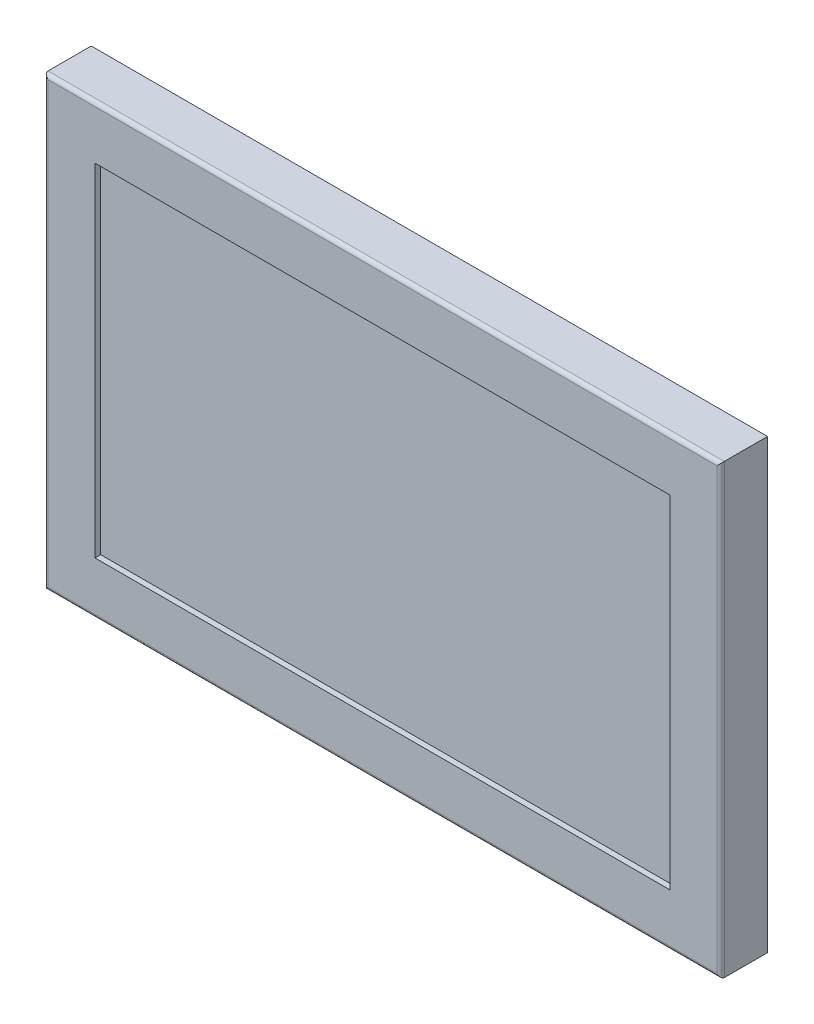
from build123d import *

# Parameters (mm, degrees)
SKETCH_1_W                  = 180
SKETCH_1_H                  = 119
EXTRUDE_1_DEPTH             = 12.5
SKETCH_2_W                  = 153
SKETCH_2_H                  = 91
CUT_EXTRUDE_1_DEPTH         = 1.5
SKETCH_3_W                  = 154.4
SKETCH_3_H                  = 94.5
EXTRUDE_2_DEPTH             = 31.5
SKETCH_7_R                  = 1.6
EXTRUDE_4_DEPTH             = 3
PATTERN_LINEAR_1_COUNT      = 5
PATTERN_LINEAR_1_PITCH      = 13.5
SKETCH_8_R                  = 1.75
CUT_EXTRUDE_3_DEPTH         = 3
SKETCH_9_R                  = 1.5
EXTRUDE_5_DEPTH             = 3
FILLET_1_R                  = 1.5
HOLE_WIZARD_M4_1_AT_2_COUNT = 2
HOLE_WIZARD_M4_1_AT_2_PITCH = 75
HOLE_WIZARD_M4_1_AT_3_COUNT = 2
HOLE_WIZARD_M4_1_AT_3_PITCH = 75
HOLE_WIZARD_M4_1_AT_4_COUNT = 2
HOLE_WIZARD_M4_1_AT_4_PITCH = 106.066017178
SKETCH_12_W                 = 10
SKETCH_12_H                 = 12.5
CUT_EXTRUDE_4_DEPTH         = 5
SKETCH_13_W                 = 9.5
SKETCH_13_H                 = 10
SKETCH_13_R                 = 3
EXTRUDE_6_DEPTH             = 5
SKETCH_13_R_2               = 0.75
EXTRUDE_6_2_DEPTH           = 5
FILLET_2_R                  = 0.75
SKETCH_14_R                 = 5
CUT_EXTRUDE_5_DEPTH         = 2
SKETCH_15_R                 = 4.125
SKETCH_15_R_2               = 1.675
EXTRUDE_7_DEPTH             = 6.5
FILLET_3_R                  = 0.5
CUT_EXTRUDE_6_DEPTH         = 3
CUT_EXTRUDE_7_DEPTH         = 3
EXTRUDE_8_DEPTH             = 5
EXTRUDE_9_DEPTH             = 5
CUT_EXTRUDE_8_DEPTH         = 3
SKETCH_21_R                 = 2.25
FILLET_8_R                  = 1
SKETCH_22_R                 = 1
CUT_EXTRUDE_9_DEPTH         = 10
SCALE1_SCALE                = 2


with BuildPart() as part:
    # 스케치1 → 보스-돌출1 (new body)
    with BuildSketch(Plane.XY):
        Rectangle(SKETCH_1_W, SKETCH_1_H)
    extrude(amount=-EXTRUDE_1_DEPTH)

    # 스케치2 → 컷-돌출1 (cut)
    with BuildSketch(Plane.XY):
        Rectangle(SKETCH_2_W, SKETCH_2_H)
    extrude(amount=-CUT_EXTRUDE_1_DEPTH, mode=Mode.SUBTRACT)

    # 필렛8
    fillet_8_edges = [part.edges().sort_by_distance(p)[0] for p in [
        (0, -59.5, 0),
        (90, 0, 0),
        (0, 59.5, 0),
        (-90, 0, 0),
    ]]
    fillet(fillet_8_edges, radius=FILLET_8_R)


with BuildPart() as body_2:
    # 스케치3 → 보스-돌출2 (new body)
    with BuildSketch(Plane(origin=(0, 0, -12.5), x_dir=(-1, 0, 0), z_dir=(0, 0, -1))):
        with Locations((0, 4.25)):
            Rectangle(SKETCH_3_W, SKETCH_3_H)
    extrude(amount=EXTRUDE_2_DEPTH)

    # 스케치7 → 보스-돌출4 (add)
    with BuildSketch(Plane(origin=(0, 51.5, 0), x_dir=(1, 0, 0), z_dir=(0, 1, 0))):
        with Locations((-40.2, 22.5)):
            Circle(SKETCH_7_R)
    extrude_4 = extrude(amount=EXTRUDE_4_DEPTH)

    # 선형 패턴1: 보스-돌출4 ×5
    with Locations(*[(i * PATTERN_LINEAR_1_PITCH, 0, 0) for i in range(1, PATTERN_LINEAR_1_COUNT)]):
        add(extrude_4)

    # 스케치8 → 컷-돌출3 (cut)
    with BuildSketch(Plane(origin=(0, 51.5, 0), x_dir=(1, 0, 0), z_dir=(0, 1, 0))):
        with Locations((25.8, 22.5)):
            Circle(SKETCH_8_R)
    extrude(amount=-CUT_EXTRUDE_3_DEPTH, mode=Mode.SUBTRACT)

    # 스케치9 → 보스-돌출5 (add)
    with BuildSketch(Plane(origin=(0, 48.5, 0), x_dir=(1, 0, 0), z_dir=(0, 1, 0))):
        with Locations((25.8, 22.5)):
            Circle(SKETCH_9_R)
    extrude(amount=EXTRUDE_5_DEPTH)

    # 필렛1
    fillet_1_edges = [body_2.edges().sort_by_distance(p)[0] for p in [
        (24.3, 51.5, -22.5),
    ]]
    fillet(fillet_1_edges, radius=FILLET_1_R)

    # 스케치10 → M4 나사 구멍1 (revolve, cut)
    with BuildSketch(Plane(origin=(37.5, 42, -44), x_dir=(0, 1, 0), z_dir=(1, 0, 0))):
        Polygon((0, 0), (0, 12.491420021), (1.65, 11.5), (1.65, 0), align=None)
    hole_wizard_m4_1 = revolve(axis=Axis((37.5, 42, -50.35), (0, 0, 1)), mode=Mode.SUBTRACT)

    # M4 나사 구멍1 at 2: M4 나사 구멍1 ×2
    with Locations(*[(-i * HOLE_WIZARD_M4_1_AT_2_PITCH, 0, 0) for i in range(1, HOLE_WIZARD_M4_1_AT_2_COUNT)]):
        add(hole_wizard_m4_1, mode=Mode.SUBTRACT)

    # M4 나사 구멍1 at 3: M4 나사 구멍1 ×2
    with Locations(*[(0, -i * HOLE_WIZARD_M4_1_AT_3_PITCH, 0) for i in range(1, HOLE_WIZARD_M4_1_AT_3_COUNT)]):
        add(hole_wizard_m4_1, mode=Mode.SUBTRACT)

    # M4 나사 구멍1 at 4: M4 나사 구멍1 ×2
    with Locations(*[Vector(-0.7071067811865476, -0.7071067811865476, 0) * (i * HOLE_WIZARD_M4_1_AT_4_PITCH) for i in range(1, HOLE_WIZARD_M4_1_AT_4_COUNT)]):
        add(hole_wizard_m4_1, mode=Mode.SUBTRACT)

    # 스케치12 → 컷-돌출4 (cut)
    with BuildSketch(Plane.XZ.offset(43)):
        with Locations((-30.2, -22.5)):
            Rectangle(SKETCH_12_W, SKETCH_12_H)
    extrude(amount=-CUT_EXTRUDE_4_DEPTH, mode=Mode.SUBTRACT)

    # 스케치14 → 컷-돌출5 (cut)
    with BuildSketch(Plane.XZ.offset(43)):
        with Locations((-19.2, -22.5)):
            Circle(SKETCH_14_R)
    extrude(amount=-CUT_EXTRUDE_5_DEPTH, mode=Mode.SUBTRACT)

    # 스케치16 → 컷-돌출6 (cut)
    with BuildSketch(Plane.XZ.offset(43)):
        with BuildLine():
            Line((11.15, -28), (-6.85, -28))
            ThreePointArc((-6.85, -28), (-8.004263662, -27.457953756), (-8.32430828, -26.223567197))
            Line((-8.32430828, -26.223567197), (-8.282389431, -26))
            Line((-8.282389431, -26), (-10.6, -26))
            ThreePointArc((-10.6, -26), (-14.1, -22.5), (-10.6, -19))
            Line((-10.6, -19), (-6.969889431, -19))
            Line((-6.969889431, -19), (-6.82430828, -18.223567197))
            ThreePointArc((-6.82430828, -18.223567197), (-6.307953756, -17.345736338), (-5.35, -17))
            Line((-5.35, -17), (9.65, -17))
            ThreePointArc((9.65, -17), (10.607953756, -17.345736338), (11.12430828, -18.223567197))
            Line((11.12430828, -18.223567197), (11.269889431, -19))
            Line((11.269889431, -19), (14.9, -19))
            ThreePointArc((14.9, -19), (18.4, -22.5), (14.9, -26))
            Line((14.9, -26), (12.582389431, -26))
            Line((12.582389431, -26), (12.62430828, -26.223567197))
            ThreePointArc((12.62430828, -26.223567197), (12.304263662, -27.457953756), (11.15, -28))
        make_face()
    extrude(amount=-CUT_EXTRUDE_6_DEPTH, mode=Mode.SUBTRACT)

    # 스케치17 → 컷-돌출7 (cut)
    with BuildSketch(Plane.XZ.offset(43)):
        with BuildLine():
            Line((52.25, -26.5), (28.25, -26.5))
            ThreePointArc((28.25, -26.5), (27.095736338, -25.957953756), (26.77569172, -24.723567197))
            Line((26.77569172, -24.723567197), (26.817610569, -24.5))
            Line((26.817610569, -24.5), (24.5, -24.5))
            ThreePointArc((24.5, -24.5), (21, -21), (24.5, -17.5))
            Line((24.5, -17.5), (28.130110569, -17.5))
            Line((28.130110569, -17.5), (28.27569172, -16.723567197))
            ThreePointArc((28.27569172, -16.723567197), (28.792046244, -15.845736338), (29.75, -15.5))
            Line((29.75, -15.5), (50.75, -15.5))
            ThreePointArc((50.75, -15.5), (51.707953756, -15.845736338), (52.22430828, -16.723567197))
            Line((52.22430828, -16.723567197), (52.369889431, -17.5))
            Line((52.369889431, -17.5), (56, -17.5))
            ThreePointArc((56, -17.5), (59.5, -21), (56, -24.5))
            Line((56, -24.5), (53.682389431, -24.5))
            Line((53.682389431, -24.5), (53.72430828, -24.723567197))
            ThreePointArc((53.72430828, -24.723567197), (53.404263662, -25.957953756), (52.25, -26.5))
        make_face()
    extrude(amount=-CUT_EXTRUDE_7_DEPTH, mode=Mode.SUBTRACT)

    # 스케치18 → 보스-돌출8 (add)
    with BuildSketch(Plane.XZ.offset(40)):
        Polygon((-12.909401077, -22.5), (-11.754700538, -24.5), (-9.445299462, -24.5), (-8.290598923, -22.5), (-9.445299462, -20.5), (-11.754700538, -20.5), align=None)
        Polygon((12.590598923, -22.5), (13.745299462, -24.5), (16.054700538, -24.5), (17.209401077, -22.5), (16.054700538, -20.5), (13.745299462, -20.5), align=None)
        with BuildLine():
            Line((-4.6, -26.5), (8.9, -26.5))
            ThreePointArc((8.9, -26.5), (9.277726977, -26.327600871), (9.394974747, -25.929289322))
            Line((9.394974747, -25.929289322), (8.394974747, -18.929289322))
            ThreePointArc((8.394974747, -18.929289322), (8.227600871, -18.622273023), (7.9, -18.5))
            Line((7.9, -18.5), (-3.6, -18.5))
            ThreePointArc((-3.6, -18.5), (-3.927600871, -18.622273023), (-4.094974747, -18.929289322))
            Line((-4.094974747, -18.929289322), (-5.094974747, -25.929289322))
            ThreePointArc((-5.094974747, -25.929289322), (-4.977726977, -26.327600871), (-4.6, -26.5))
        make_face()
    extrude(amount=EXTRUDE_8_DEPTH)

    # 스케치19 → 보스-돌출9 (add)
    with BuildSketch(Plane.XZ.offset(40)):
        Polygon((26.809401077, -21), (25.654700538, -19), (23.345299462, -19), (22.190598923, -21), (23.345299462, -23), (25.654700538, -23), align=None)
        Polygon((53.690598923, -21), (54.845299462, -23), (57.154700538, -23), (58.309401077, -21), (57.154700538, -19), (54.845299462, -19), align=None)
        with BuildLine():
            Line((29.75, -17), (50.75, -17))
            ThreePointArc((50.75, -17), (51.103553391, -17.146446609), (51.25, -17.5))
            Line((51.25, -17.5), (51.25, -24.5))
            ThreePointArc((51.25, -24.5), (51.103553391, -24.853553391), (50.75, -25))
            Line((50.75, -25), (29.75, -25))
            ThreePointArc((29.75, -25), (29.396446609, -24.853553391), (29.25, -24.5))
            Line((29.25, -24.5), (29.25, -17.5))
            ThreePointArc((29.25, -17.5), (29.396446609, -17.146446609), (29.75, -17))
        make_face()
    extrude(amount=EXTRUDE_9_DEPTH)

    # 스케치20 → 컷-돌출8 (cut)
    with BuildSketch(Plane.XZ.offset(43)):
        with BuildLine():
            Line((-55.7, -17.5), (-55.7, -12.5))
            Line((-55.7, -12.5), (-63.7, -12.5))
            Line((-63.7, -12.5), (-63.7, -17.5))
            ThreePointArc((-63.7, -17.5), (-59.7, -21.5), (-55.7, -17.5))
        make_face()
    extrude(amount=-CUT_EXTRUDE_8_DEPTH, mode=Mode.SUBTRACT)

    # 스케치22 → 컷-돌출9 (cut)
    with BuildSketch(Plane.XZ.offset(45)):
        with Locations((24.5, -21)):
            Circle(SKETCH_22_R)
        with Locations((56, -21)):
            Circle(SKETCH_22_R)
    extrude(amount=-CUT_EXTRUDE_9_DEPTH, mode=Mode.SUBTRACT)


with BuildPart() as body_3:
    # 스케치13 → 보스-돌출6 (new body)
    with BuildSketch(Plane.XZ.offset(38)):
        with Locations((-30.2, -21.5)):
            Rectangle(SKETCH_13_W, SKETCH_13_H)
        with Locations((-30.2, -22.5)):
            Circle(SKETCH_13_R, mode=Mode.SUBTRACT)
    extrude(amount=EXTRUDE_6_DEPTH)


with BuildPart() as body_4:
    # 스케치13 → Extrude 6 2 (new body)
    with BuildSketch(Plane.XZ.offset(38)):
        with Locations((-30.2, -22.5)):
            Circle(SKETCH_13_R_2)
    extrude(amount=EXTRUDE_6_2_DEPTH)

    # 필렛2
    fillet_2_edges = [body_4.edges().sort_by_distance(p)[0] for p in [
        (-30.95, -43, -22.5),
    ]]
    fillet(fillet_2_edges, radius=FILLET_2_R)


with BuildPart() as body_5:
    # 스케치15 → 보스-돌출7 (new body)
    with BuildSketch(Plane.XZ.offset(41)):
        with Locations((-19.2, -22.5)):
            Circle(SKETCH_15_R)
        with Locations((-19.2, -22.5)):
            Circle(SKETCH_15_R_2, mode=Mode.SUBTRACT)
    extrude(amount=EXTRUDE_7_DEPTH)

    # 필렛3
    fillet_3_edges = [body_5.edges().sort_by_distance(p)[0] for p in [
        (-23.325, -47.5, -22.5),
    ]]
    fillet(fillet_3_edges, radius=FILLET_3_R)


with BuildPart() as body_6:
    # 스윕1: sweep along a curve in space
    with BuildLine() as sweep_1_path:
        Line((-59.7, -43, -17.5), (-59.7, -78.42009492, -17.5))
        ThreePointArc((-59.7, -78.42009492, -17.5), (-59.7, -86.073763567, -19.02240935), (-59.7, -92.562230544, -23.357864376))
        Line((-59.7, -92.562230544, -23.357864376), (-59.7, -97.563485023, -28.359118856))
        ThreePointArc((-59.7, -97.563485023, -28.359118856), (-59.7, -104.051952, -32.694573882), (-59.7, -111.705620647, -34.216983232))
        Line((-59.7, -111.705620647, -34.216983232), (-59.7, -122.786475518, -34.216983232))
    # 스케치21 → 스윕1 (sweep)
    with BuildSketch(Plane.XZ.offset(43)):
        with Locations((-59.7, -17.5)):
            Circle(SKETCH_21_R)
    sweep(path=sweep_1_path.line)


with BuildPart() as part_1:
    # Scale1: scaled about (0, 0, -6.718659155)
    add(part.part.scale(SCALE1_SCALE).moved(Location((0, 0, 6.718659155))))


solid = Compound([body_2.part, body_3.part, body_4.part, body_5.part, body_6.part, part_1.part])
